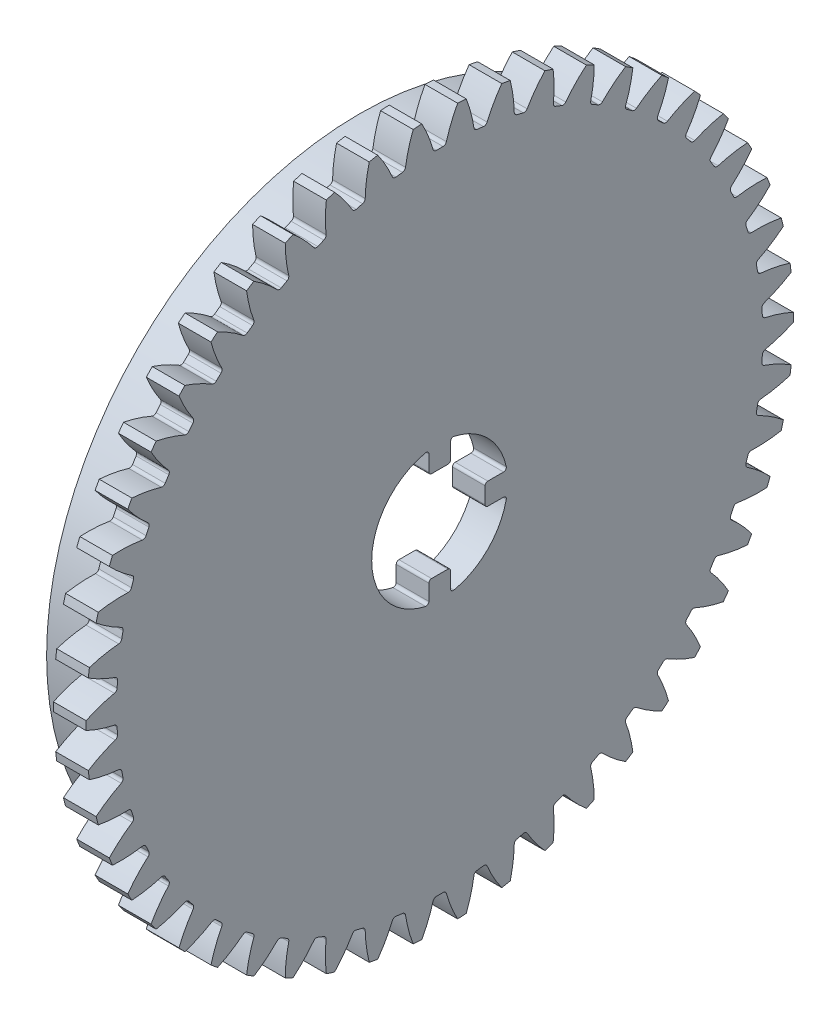
from build123d import *

# Parameters (mm, degrees)
BASPROSKE_W                = 1.2
BASPROSKE_H                = 13
TOOTHCUT_DEPTH             = 19.423897525
ROOTFILLETS_R              = 0.126
TEETHCUTS_COUNT            = 50
TEETHCUTS_ANGLE            = 352.8
ROOTFILLETS_OF_TEETHCUTS_R = 0.126
BORSKE_R                   = 2.5
BORE_DEPTH                 = 50.0000508
PIN_DEPTH                  = 1.2
FILLET_2_R                 = 0.1


with BuildPart() as part:
    # BasProSke → Base-Revolve (revolve)
    with BuildSketch(Plane(origin=(0, 0, 0), x_dir=(1, 0, 0), z_dir=(0, 1, 0)), mode=Mode.PRIVATE) as base_revolve_sk:
        with Locations((0.6, 6.5)):
            Rectangle(BASPROSKE_W, BASPROSKE_H)
    revolve(base_revolve_sk.sketch.rotate(Axis((-10, 0, 0), (1, 0, 0)), 180), axis=Axis((-10, 0, 0), (1, 0, 0)))

    # TooCutSke → ToothCut (cut, through all)
    with BuildSketch(Plane(origin=(0, 0, 0), x_dir=(0, 0, -1), z_dir=(1, 0, 0))):
        with BuildLine():
            ThreePointArc((0.218701072, 11.871985758), (0, 11.874), (-0.218701072, 11.871985758))
            ThreePointArc((-0.218701072, 11.871985758), (-0.410224227, 12.453928998), (-0.671481128, 13.008080498))
            ThreePointArc((-0.671481128, 13.008080498), (0, 13.0254), (0.671481128, 13.008080498))
            ThreePointArc((0.671481128, 13.008080498), (0.410224227, 12.453928998), (0.218701072, 11.871985758))
        make_face()
    toothcut = extrude(amount=TOOTHCUT_DEPTH, mode=Mode.SUBTRACT)

    # RootFillets
    rootfillets_edges = [part.edges().sort_by_distance(p)[0] for p in [
        (0.6, 11.871985758, -0.218701072),
        (0.6, 11.871985758, 0.218701072),
    ]]
    fillet(rootfillets_edges, radius=ROOTFILLETS_R)

    # TeethCuts: ToothCut ×50 about axis
    teethcuts_axis = Axis((-10, 0, 0), (1, 0, 0))
    for i in range(1, TEETHCUTS_COUNT):
        add(toothcut.rotate(teethcuts_axis, i * TEETHCUTS_ANGLE / (TEETHCUTS_COUNT - 1)), mode=Mode.SUBTRACT)

    # RootFillets of TeethCuts
    rootfillets_of_teethcuts_edges = [part.edges().sort_by_distance(p)[0] for p in [
        (0.6, 11.805782117, 1.270977815),
        (0.6, 11.750961092, 1.704930912),
        (0.6, 11.553394239, 2.740612623),
        (0.6, 11.44461675, 3.164272974),
        (0.6, 11.118802433, 4.167026333),
        (0.6, 10.957783965, 4.573712561),
        (0.6, 10.50886047, 5.527723548),
        (0.6, 10.29814038, 5.911021968),
        (0.6, 9.7331875, 6.80124526),
        (0.6, 9.476088971, 7.155111028),
        (0.6, 8.804016349, 7.967507272),
        (0.6, 8.504593977, 8.286359712),
        (0.6, 7.7360006, 9.008116935),
        (0.6, 7.398976456, 9.286927554),
        (0.6, 6.545983501, 9.906663212),
        (0.6, 6.176672657, 10.141035001),
        (0.6, 5.252732332, 10.648975493),
        (0.6, 4.856959039, 10.835212268),
        (0.6, 3.876642436, 11.223347069),
        (0.6, 3.460648277, 11.358511764),
        (0.6, 2.439415573, 11.620719757),
        (0.6, 2.009761024, 11.702680745),
        (0.6, 0.963717669, 11.834826752),
        (0.6, 0.527178638, 11.86229146),
        (0.6, -0.527178638, 11.86229146),
        (0.6, -0.963717669, 11.834826752),
        (0.6, -2.009761024, 11.702680745),
        (0.6, -2.439415573, 11.620719757),
        (0.6, -3.460648277, 11.358511764),
        (0.6, -3.876642436, 11.223347069),
        (0.6, -4.856959039, 10.835212268),
        (0.6, -5.252732332, 10.648975493),
        (0.6, -6.176672657, 10.141035001),
        (0.6, -6.545983501, 9.906663212),
        (0.6, -7.398976456, 9.286927554),
        (0.6, -7.7360006, 9.008116935),
        (0.6, -8.504593977, 8.286359712),
        (0.6, -8.804016349, 7.967507272),
        (0.6, -9.476088971, 7.155111028),
        (0.6, -9.7331875, 6.80124526),
        (0.6, -10.29814038, 5.911021968),
        (0.6, -10.50886047, 5.527723548),
        (0.6, -10.957783965, 4.573712561),
        (0.6, -11.118802433, 4.167026333),
        (0.6, -11.44461675, 3.164272974),
        (0.6, -11.553394239, 2.740612623),
        (0.6, -11.750961092, 1.704930912),
        (0.6, -11.805782117, 1.270977815),
        (0.6, -11.871985758, 0.218701072),
        (0.6, -11.871985758, -0.218701072),
        (0.6, -11.805782117, -1.270977815),
        (0.6, -11.750961092, -1.704930912),
        (0.6, -11.553394239, -2.740612623),
        (0.6, -11.44461675, -3.164272974),
        (0.6, -11.118802433, -4.167026333),
        (0.6, -10.957783965, -4.573712561),
        (0.6, -10.50886047, -5.527723548),
        (0.6, -10.29814038, -5.911021968),
        (0.6, -9.7331875, -6.80124526),
        (0.6, -9.476088971, -7.155111028),
        (0.6, -8.804016349, -7.967507272),
        (0.6, -8.504593977, -8.286359712),
        (0.6, -7.7360006, -9.008116935),
        (0.6, -7.398976456, -9.286927554),
        (0.6, -6.545983501, -9.906663212),
        (0.6, -6.176672657, -10.141035001),
        (0.6, -5.252732332, -10.648975493),
        (0.6, -4.856959039, -10.835212268),
        (0.6, -3.876642436, -11.223347069),
        (0.6, -3.460648277, -11.358511764),
        (0.6, -2.439415573, -11.620719757),
        (0.6, -2.009761024, -11.702680745),
        (0.6, -0.963717669, -11.834826752),
        (0.6, -0.527178638, -11.86229146),
        (0.6, 0.527178638, -11.86229146),
        (0.6, 0.963717669, -11.834826752),
        (0.6, 2.009761024, -11.702680745),
        (0.6, 2.439415573, -11.620719757),
        (0.6, 3.460648277, -11.358511764),
        (0.6, 3.876642436, -11.223347069),
        (0.6, 4.856959039, -10.835212268),
        (0.6, 5.252732332, -10.648975493),
        (0.6, 6.176672657, -10.141035001),
        (0.6, 6.545983501, -9.906663212),
        (0.6, 7.398976456, -9.286927554),
        (0.6, 7.7360006, -9.008116935),
        (0.6, 8.504593977, -8.286359712),
        (0.6, 8.804016349, -7.967507272),
        (0.6, 9.476088971, -7.155111028),
        (0.6, 9.7331875, -6.80124526),
        (0.6, 10.29814038, -5.911021968),
        (0.6, 10.50886047, -5.527723548),
        (0.6, 10.957783965, -4.573712561),
        (0.6, 11.118802433, -4.167026333),
        (0.6, 11.44461675, -3.164272974),
        (0.6, 11.553394239, -2.740612623),
        (0.6, 11.750961092, -1.704930912),
        (0.6, 11.805782117, -1.270977815),
    ]]
    fillet(rootfillets_of_teethcuts_edges, radius=ROOTFILLETS_OF_TEETHCUTS_R)

    # BorSke → Bore (cut, symmetric)
    with BuildSketch(Plane(origin=(0, 0, 0), x_dir=(0, 0, -1), z_dir=(1, 0, 0))):
        with Locations(Location((0, 0, 0), (0, 0, 180))):
            Circle(BORSKE_R)
    extrude(amount=BORE_DEPTH, both=True, mode=Mode.SUBTRACT)

    # PinSke → Pin (add)
    with BuildSketch(Plane(origin=(1.2, 0, 0), x_dir=(0, 0, -1), z_dir=(1, 0, 0))):
        with BuildLine():
            Line((-0.4, 2.467792536), (-0.4, 1.667792536))
            Line((-0.4, 1.667792536), (0.4, 1.667792536))
            Line((0.4, 1.667792536), (0.4, 2.467792536))
            ThreePointArc((0.4, 2.467792536), (0, 2.5), (-0.4, 2.467792536))
        make_face()
        with BuildLine():
            Line((-0.4, -2.467792536), (-0.4, -1.667792536))
            Line((-0.4, -1.667792536), (0.4, -1.667792536))
            Line((0.4, -1.667792536), (0.4, -2.467792536))
            ThreePointArc((0.4, -2.467792536), (0, -2.5), (-0.4, -2.467792536))
        make_face()
        with BuildLine():
            Line((2.467792536, 0.4), (1.667792536, 0.4))
            Line((1.667792536, 0.4), (1.667792536, -0.4))
            Line((1.667792536, -0.4), (2.467792536, -0.4))
            ThreePointArc((2.467792536, -0.4), (2.5, 0), (2.467792536, 0.4))
        make_face()
    extrude(amount=-PIN_DEPTH)

    # Fillet 2
    fillet_2_edges = [part.edges().sort_by_distance(p)[0] for p in [
        (0.6, 2.467792536, 0.4),
        (0.6, 2.467792536, -0.4),
        (0.6, 1.667792536, -0.4),
        (0.6, 1.667792536, 0.4),
        (0.6, -2.467792536, -0.4),
        (0.6, -2.467792536, 0.4),
        (0.6, -1.667792536, 0.4),
        (0.6, -1.667792536, -0.4),
        (0.6, 0.4, -2.467792536),
        (0.6, -0.4, -2.467792536),
        (0.6, -0.4, -1.667792536),
        (0.6, 0.4, -1.667792536),
    ]]
    fillet(fillet_2_edges, radius=FILLET_2_R)

    # EdgeSke → Edge 2 (revolve)
    with BuildSketch(Plane.XY, mode=Mode.PRIVATE) as edge_2_sk:
        Polygon((-1.75, 10.5), (-1.75, 11.5), (0, 11.5), (0, 10.5), (0, 9.031575645), align=None)
    revolve(edge_2_sk.sketch.rotate(Axis((-10, 0, 0), (1, 0, 0)), 90), axis=Axis((-10, 0, 0), (1, 0, 0)))


solid = part.part
